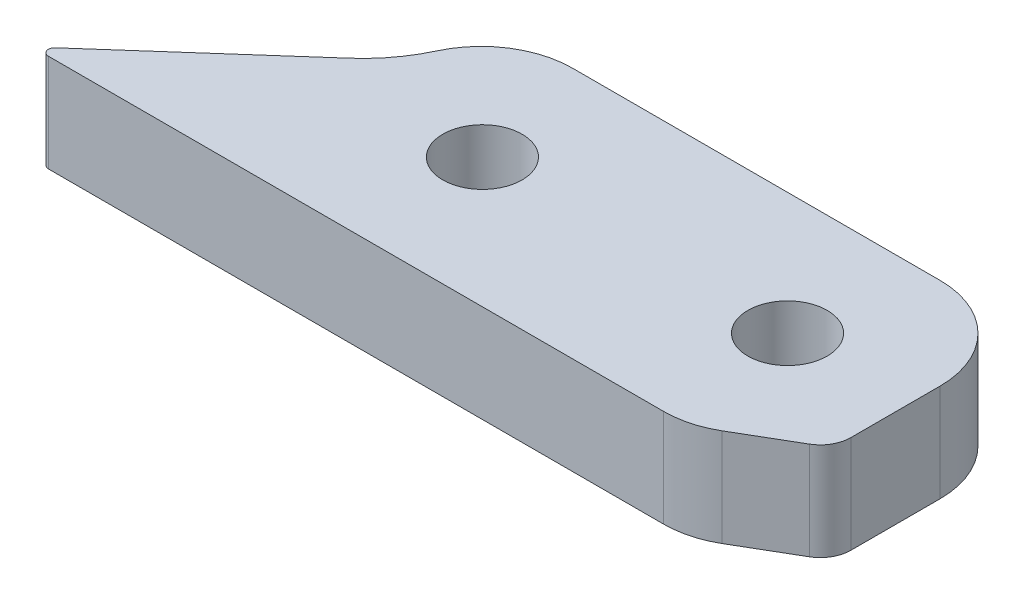
from build123d import *

# Parameters (mm, degrees)
SKETCH1_R           = 2.6
BOSS_EXTRUDE1_DEPTH = 6.4
FILLET1_R           = 6
FILLET2_R           = 10
FILLET3_R           = 0.4
FILLET4_R           = 2


with BuildPart() as part:
    # Sketch1 → Boss-Extrude1 (new body)
    with BuildSketch(Plane(origin=(0, 0, 0), x_dir=(1, 0, 0), z_dir=(0, 1, 0))):
        Polygon((36, -13), (36, 0), (0, 0), (0, -5), (-13, -16.5), (-1.455462178, -16.5), (30, -16.5), align=None)
        with Locations(Location((28, -8, 0), (0, 0, 270))):
            Circle(SKETCH1_R, mode=Mode.SUBTRACT)
        with Locations(Location((8, -8, 0), (0, 0, 270))):
            Circle(SKETCH1_R, mode=Mode.SUBTRACT)
    extrude(amount=BOSS_EXTRUDE1_DEPTH)

    # Fillet1
    # the kernel refuses this fillet: 6 mm, written as the material it takes off along each edge
    with BuildSketch(Plane(origin=(30, -4.05523712, 16.5), x_dir=(-1, 0, 0), z_dir=(0, 1, 0))) as fillet1_piece_1:
        with BuildLine():
            CenterArc((FILLET1_R * 0.27034914135, -FILLET1_R), FILLET1_R, 90, 30.256437164)
            Line((-FILLET1_R * 0.233521884174, -FILLET1_R * 0.136221099102), (-FILLET1_R * 0.243599304685, -FILLET1_R * 0.118945521084))
            Line((-FILLET1_R * 0.243599304685, -FILLET1_R * 0.118945521084), (-FILLET1_R * 0.005406982827, FILLET1_R * 0.02))
            Line((-FILLET1_R * 0.005406982827, FILLET1_R * 0.02), (FILLET1_R * 0.27034914135, FILLET1_R * 0.02))
            Line((FILLET1_R * 0.27034914135, FILLET1_R * 0.02), (FILLET1_R * 0.27034914135, 0))
        make_face()
    extrude(amount=14.51047424, mode=Mode.SUBTRACT)
    with BuildSketch(Plane(origin=(36, -15, 0), x_dir=(0, 0, 1), z_dir=(0, 1, 0))) as fillet1_piece_2:
        with BuildLine():
            CenterArc((FILLET1_R, -FILLET1_R), FILLET1_R, 90, 90)
            Line((0, -FILLET1_R), (-FILLET1_R * 0.02, -FILLET1_R))
            Line((-FILLET1_R * 0.02, -FILLET1_R), (-FILLET1_R * 0.02, FILLET1_R * 0.02))
            Line((-FILLET1_R * 0.02, FILLET1_R * 0.02), (FILLET1_R, FILLET1_R * 0.02))
            Line((FILLET1_R, FILLET1_R * 0.02), (FILLET1_R, 0))
        make_face()
    extrude(amount=36.4, mode=Mode.SUBTRACT)
    with BuildSketch(Plane(origin=(0, -14.790199458, 0), x_dir=(0, 0, 1), z_dir=(0, 1, 0))) as fillet1_piece_3:
        with BuildLine():
            CenterArc((6, 5.916079783), FILLET1_R, 180, 80.405931773)
            Line((0, 5.916079783), (-0.12, 5.916079783))
            Line((-0.12, 5.916079783), (-0.12, 0))
            Line((-0.12, 0), (0, -0.12))
            ThreePointArc((0, -0.12), (2.5, -0.12), (4.98, -0.118321596))
            Line((4.98, -0.118321596), (5, 0))
        make_face()
    extrude(amount=35.980398916, mode=Mode.SUBTRACT)

    # Fillet2
    fillet2_edges = [part.edges().sort_by_distance(p)[0] for p in [
        (0, 3.2, 5),
    ]]
    fillet(fillet2_edges, radius=FILLET2_R)

    # Fillet3
    fillet3_edges = [part.edges().sort_by_distance(p)[0] for p in [
        (-13, 3.2, 16.5),
    ]]
    fillet(fillet3_edges, radius=FILLET3_R)

    # Fillet4
    fillet4_edges = [part.edges().sort_by_distance(p)[0] for p in [
        (36, 3.2, 13),
    ]]
    fillet(fillet4_edges, radius=FILLET4_R)


solid = part.part
